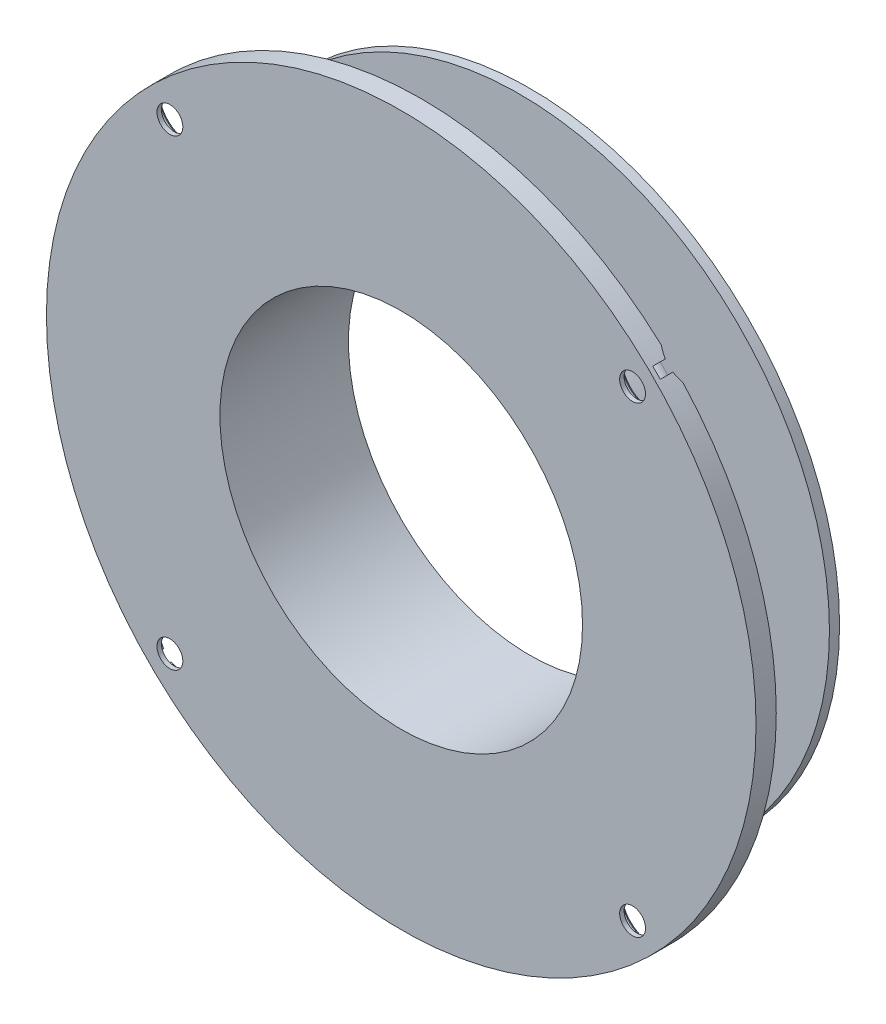
from build123d import *

# Parameters (mm, degrees)
CBORE_FOR_10_BINDING_HEAD_MACHINE_S_2_COUNT = 2
CBORE_FOR_10_BINDING_HEAD_MACHINE_S_2_PITCH = 91.44
CBORE_FOR_10_BINDING_HEAD_MACHINE_S_3_COUNT = 2
CBORE_FOR_10_BINDING_HEAD_MACHINE_S_3_PITCH = 129.315688143
CBORE_FOR_10_BINDING_HEAD_MACHINE_S_4_COUNT = 2
CBORE_FOR_10_BINDING_HEAD_MACHINE_S_4_PITCH = 91.44


with BuildPart() as part:
    # Sketch1 → Revolve1 (revolve)
    with BuildSketch(Plane(origin=(0, 0, 0), x_dir=(1, 0, 0), z_dir=(0, 1, 0))):
        with BuildLine():
            Line((-1.000000064, -24.96), (-1.000000064, -10.640000064))
            ThreePointArc((-1.000000064, -10.640000064), (-1.74394884, -8.84394884), (-3.540000064, -8.100000064))
            Line((-3.540000064, -8.100000064), (-24.4, -8.100000064))
            Line((-24.4, -8.100000064), (-24.4, -6.100000064))
            Line((-24.4, -6.100000064), (-1, -6.100000064))
            Line((-1, -6.100000064), (1, -6.100000064))
            Line((1, -6.100000064), (1, -31.500000128))
            Line((1, -31.500000128), (-33.29, -31.500000128))
            Line((-33.29, -31.500000128), (-33.29, -27.5))
            Line((-33.29, -27.5), (-3.540000064, -27.5))
            ThreePointArc((-3.540000064, -27.5), (-1.74394884, -26.756051224), (-1.000000064, -24.96))
        make_face()
    revolve(axis=Axis((36.83, 0, 32.45), (0, 0, -1)))

    # Sketch7 → CBORE for #10 Binding Head Machine Screw1 (revolve, cut)
    with BuildSketch(Plane(origin=(82.55, 45.72, 27.5), x_dir=(0, 1, 0), z_dir=(1, 0, 0))):
        Polygon((0, 0), (0, 4.000000128), (2.5527, 4.000000128), (2.5527, 3.1242), (5.55625, 3.1242), (5.55625, 0.635), (6.19125, 0), align=None)
    cbore_for_10_binding_head_machine_screw = revolve(axis=Axis((82.55, 45.72, 21.15), (0, 0, 1)), mode=Mode.SUBTRACT)

    # CBORE for _10 Binding Head Machine S 2: CBORE for #10 Binding Head Machine Screw1 ×2
    with Locations(*[(-i * CBORE_FOR_10_BINDING_HEAD_MACHINE_S_2_PITCH, 0, 0) for i in range(1, CBORE_FOR_10_BINDING_HEAD_MACHINE_S_2_COUNT)]):
        add(cbore_for_10_binding_head_machine_screw, mode=Mode.SUBTRACT)

    # CBORE for _10 Binding Head Machine S 3: CBORE for #10 Binding Head Machine Screw1 ×2
    with Locations(*[Vector(-0.7071067811865476, -0.7071067811865476, 0) * (i * CBORE_FOR_10_BINDING_HEAD_MACHINE_S_3_PITCH) for i in range(1, CBORE_FOR_10_BINDING_HEAD_MACHINE_S_3_COUNT)]):
        add(cbore_for_10_binding_head_machine_screw, mode=Mode.SUBTRACT)

    # CBORE for _10 Binding Head Machine S 4: CBORE for #10 Binding Head Machine Screw1 ×2
    with Locations(*[(0, -i * CBORE_FOR_10_BINDING_HEAD_MACHINE_S_4_PITCH, 0) for i in range(1, CBORE_FOR_10_BINDING_HEAD_MACHINE_S_4_COUNT)]):
        add(cbore_for_10_binding_head_machine_screw, mode=Mode.SUBTRACT)


solid = part.part
